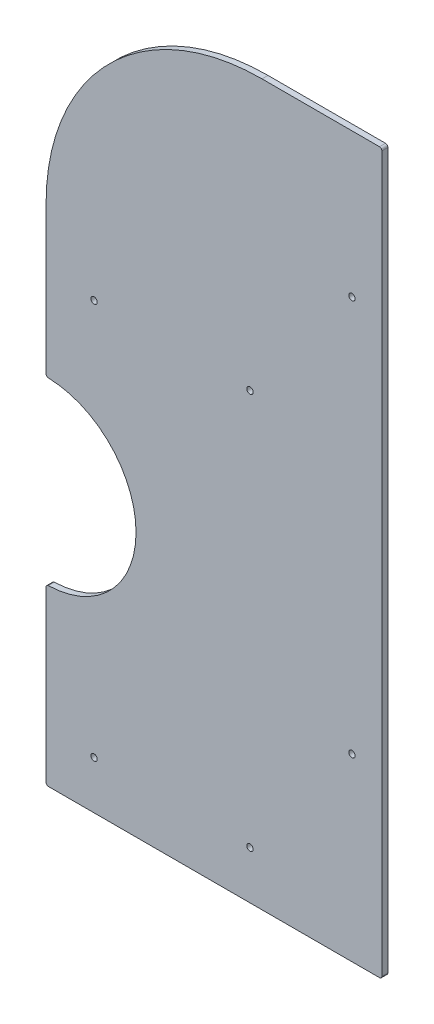
from build123d import *

# Parameters (mm, degrees)
SKETCH1_W           = 355.6
SKETCH1_H           = 762
BOSS_EXTRUDE1_DEPTH = 6.35
FILLET1_R           = 228.6
SKETCH3_R           = 95.25
CUT_EXTRUDE1_DEPTH  = 421.492761531
SKETCH2_R           = 3.3734375
CUT_EXTRUDE2_DEPTH  = 421.492761531
FILLET2_R           = 2.54


with BuildPart() as part:
    # Sketch1 → Boss-Extrude1 (new body)
    with BuildSketch(Plane.XY):
        Rectangle(SKETCH1_W, SKETCH1_H)
    extrude(amount=BOSS_EXTRUDE1_DEPTH)

    # Fillet1
    fillet1_edges = [part.edges().sort_by_distance(p)[0] for p in [
        (-177.8, 381, 3.175),
    ]]
    fillet(fillet1_edges, radius=FILLET1_R)

    # Sketch3 → Cut-Extrude1 (cut, through all)
    with BuildSketch(Plane.XY.offset(6.35)):
        with Locations((-177.8, -101.6)):
            Circle(SKETCH3_R)
    extrude(amount=-CUT_EXTRUDE1_DEPTH, mode=Mode.SUBTRACT)

    # Sketch2 → Cut-Extrude2 (cut, through all)
    with BuildSketch(Plane.XY.offset(6.35)):
        with Locations((146.05, 228.6)):
            Circle(SKETCH2_R)
        with Locations((38.1, 88.9)):
            Circle(SKETCH2_R)
        with Locations((-127, 88.9)):
            Circle(SKETCH2_R)
        with Locations((146.05, -190.5)):
            Circle(SKETCH2_R)
        with Locations((38.1, -330.2)):
            Circle(SKETCH2_R)
        with Locations((-127, -330.2)):
            Circle(SKETCH2_R)
    extrude(amount=-CUT_EXTRUDE2_DEPTH, mode=Mode.SUBTRACT)

    # Fillet2
    fillet2_edges = [part.edges().sort_by_distance(p)[0] for p in [
        (-177.8, -6.35, 3.175),
        (-177.8, -196.85, 3.175),
        (-177.8, -381, 3.175),
        (177.8, -381, 3.175),
        (177.8, 381, 3.175),
    ]]
    fillet(fillet2_edges, radius=FILLET2_R)


solid = part.part
